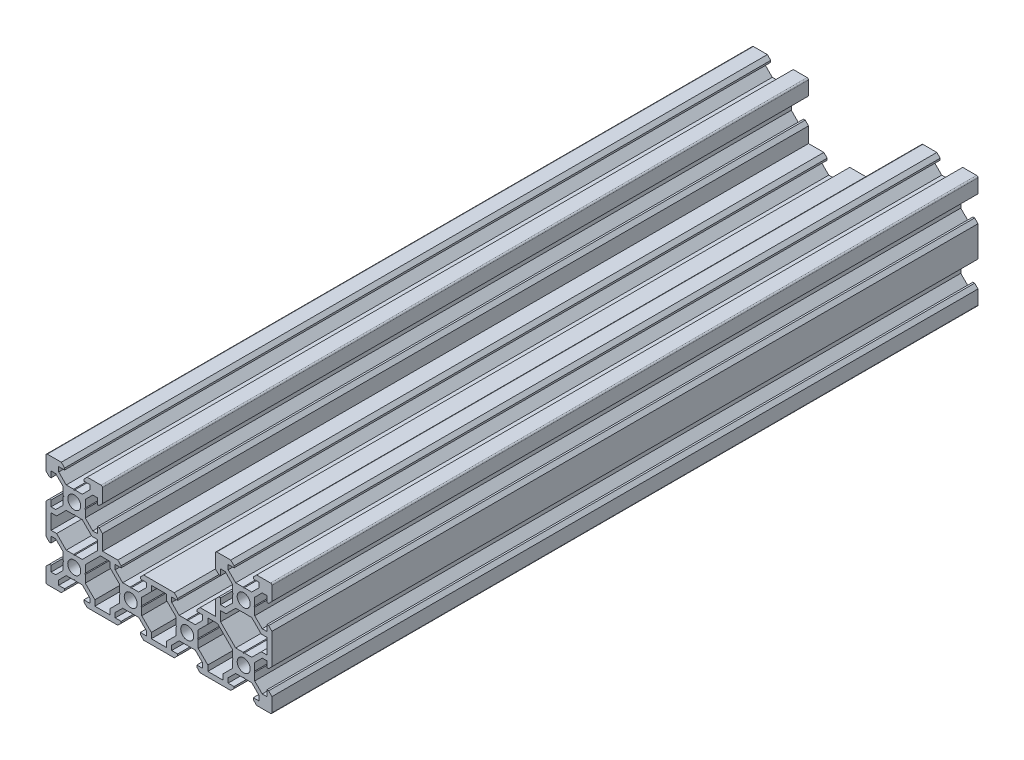
from build123d import *

# Parameters (mm, degrees)
ESQUISSE1_R             = 2.3
BOSS_EXTRU_1_DEPTH      = 250
ENL_V_MAT_EXTRU_1_DEPTH = 254.574446662


with BuildPart() as part:
    # Esquisse1 → Boss.-Extru.1 (new body)
    with BuildSketch(Plane.XY):
        with BuildLine():
            Line((-3.9, 2.839339828), (-6.560660172, 5.5))
            Line((-6.560660172, 5.5), (-8.2, 5.5))
            Line((-8.2, 5.5), (-8.2, 3.395))
            Line((-8.2, 3.395), (-8.815, 3.395))
            Line((-8.815, 3.395), (-10, 4.58))
            Line((-10, 4.58), (-10, 9.5))
            ThreePointArc((-10, 9.5), (-9.853553391, 9.853553391), (-9.5, 10))
            Line((-9.5, 10), (-4.58, 10))
            Line((-4.58, 10), (-3.395, 8.815))
            Line((-3.395, 8.815), (-3.395, 8.2))
            Line((-3.395, 8.2), (-5.5, 8.2))
            Line((-5.5, 8.2), (-5.5, 6.560660172))
            Line((-5.5, 6.560660172), (-2.839339828, 3.9))
            Line((-2.839339828, 3.9), (2.839339828, 3.9))
            Line((2.839339828, 3.9), (5.5, 6.560660172))
            Line((5.5, 6.560660172), (5.5, 8.2))
            Line((5.5, 8.2), (3.395, 8.2))
            Line((3.395, 8.2), (3.395, 8.815))
            Line((3.395, 8.815), (4.58, 10))
            Line((4.58, 10), (9.5, 10))
            ThreePointArc((9.5, 10), (9.853553391, 9.853553391), (10, 9.5))
            Line((10, 9.5), (10, 4.58))
            Line((10, 4.58), (8.815, 3.395))
            Line((8.815, 3.395), (8.2, 3.395))
            Line((8.2, 3.395), (8.2, 5.5))
            Line((8.2, 5.5), (6.560660172, 5.5))
            Line((6.560660172, 5.5), (3.9, 2.839339828))
            Line((3.9, 2.839339828), (3.9, -2.839339828))
            Line((3.9, -2.839339828), (6.560660172, -5.5))
            Line((6.560660172, -5.5), (8.2, -5.5))
            Line((8.2, -5.5), (8.2, -3.395))
            Line((8.2, -3.395), (8.815, -3.395))
            Line((8.815, -3.395), (10, -4.58))
            Line((10, -4.58), (10, -10))
            Line((10, -10), (15.42, -10))
            Line((15.42, -10), (16.605, -11.185))
            Line((16.605, -11.185), (16.605, -11.8))
            Line((16.605, -11.8), (14.5, -11.8))
            Line((14.5, -11.8), (14.5, -13.439339828))
            Line((14.5, -13.439339828), (17.160660172, -16.1))
            Line((17.160660172, -16.1), (22.839339828, -16.1))
            Line((22.839339828, -16.1), (25.5, -13.439339828))
            Line((25.5, -13.439339828), (25.5, -11.8))
            Line((25.5, -11.8), (23.395, -11.8))
            Line((23.395, -11.8), (23.395, -11.185))
            Line((23.395, -11.185), (24.58, -10))
            Line((24.58, -10), (30, -10))
            Line((30, -10), (30, -11.8))
            Line((30, -11.8), (27.3, -11.8))
            Line((27.3, -11.8), (27.3, -13.760660172))
            Line((27.3, -13.760660172), (23.9, -17.160660172))
            Line((23.9, -17.160660172), (23.9, -22.839339828))
            Line((23.9, -22.839339828), (27.3, -26.239339828))
            Line((27.3, -26.239339828), (27.3, -28.2))
            Line((27.3, -28.2), (30, -28.2))
            Line((30, -28.2), (30, -30))
            Line((30, -30), (24.58, -30))
            Line((24.58, -30), (23.395, -28.815))
            Line((23.395, -28.815), (23.395, -28.2))
            Line((23.395, -28.2), (25.5, -28.2))
            Line((25.5, -28.2), (25.5, -26.560660172))
            Line((25.5, -26.560660172), (22.839339828, -23.9))
            Line((22.839339828, -23.9), (17.160660172, -23.9))
            Line((17.160660172, -23.9), (14.5, -26.560660172))
            Line((14.5, -26.560660172), (14.5, -28.2))
            Line((14.5, -28.2), (16.605, -28.2))
            Line((16.605, -28.2), (16.605, -28.815))
            Line((16.605, -28.815), (15.42, -30))
            Line((15.42, -30), (4.58, -30))
            Line((4.58, -30), (3.395, -28.815))
            Line((3.395, -28.815), (3.395, -28.2))
            Line((3.395, -28.2), (5.5, -28.2))
            Line((5.5, -28.2), (5.5, -26.560660172))
            Line((5.5, -26.560660172), (2.839339828, -23.9))
            Line((2.839339828, -23.9), (-2.839339828, -23.9))
            Line((-2.839339828, -23.9), (-5.5, -26.560660172))
            Line((-5.5, -26.560660172), (-5.5, -28.2))
            Line((-5.5, -28.2), (-3.395, -28.2))
            Line((-3.395, -28.2), (-3.395, -28.815))
            Line((-3.395, -28.815), (-4.58, -30))
            Line((-4.58, -30), (-9.5, -30))
            ThreePointArc((-9.5, -30), (-9.853553391, -29.853553391), (-10, -29.5))
            Line((-10, -29.5), (-10, -24.58))
            Line((-10, -24.58), (-8.815, -23.395))
            Line((-8.815, -23.395), (-8.2, -23.395))
            Line((-8.2, -23.395), (-8.2, -25.5))
            Line((-8.2, -25.5), (-6.560660172, -25.5))
            Line((-6.560660172, -25.5), (-3.9, -22.839339828))
            Line((-3.9, -22.839339828), (-3.9, -17.160660172))
            Line((-3.9, -17.160660172), (-6.560660172, -14.5))
            Line((-6.560660172, -14.5), (-8.2, -14.5))
            Line((-8.2, -14.5), (-8.2, -16.605))
            Line((-8.2, -16.605), (-8.815, -16.605))
            Line((-8.815, -16.605), (-10, -15.42))
            Line((-10, -15.42), (-10, -4.58))
            Line((-10, -4.58), (-8.815, -3.395))
            Line((-8.815, -3.395), (-8.2, -3.395))
            Line((-8.2, -3.395), (-8.2, -5.5))
            Line((-8.2, -5.5), (-6.560660172, -5.5))
            Line((-6.560660172, -5.5), (-3.9, -2.839339828))
            Line((-3.9, -2.839339828), (-3.9, 2.839339828))
        make_face()
        Circle(ESQUISSE1_R, mode=Mode.SUBTRACT)
        with Locations((0, -20)):
            Circle(ESQUISSE1_R, mode=Mode.SUBTRACT)
        with Locations((20, -20)):
            Circle(ESQUISSE1_R, mode=Mode.SUBTRACT)
        Polygon((-2.839339828, -3.9), (-6.239339828, -7.3), (-8.2, -7.3), (-8.2, -12.7), (-6.239339828, -12.7), (-2.839339828, -16.1), (2.839339828, -16.1), (8.2, -10.739339828), (8.2, -7.3), (6.239339828, -7.3), (2.839339828, -3.9), align=None, mode=Mode.SUBTRACT)
        Polygon((3.9, -22.839339828), (7.3, -26.239339828), (7.3, -28.2), (12.7, -28.2), (12.7, -26.239339828), (16.1, -22.839339828), (16.1, -17.160660172), (12.7, -13.760660172), (12.7, -11.8), (9.260660172, -11.8), (3.9, -17.160660172), align=None, mode=Mode.SUBTRACT)
    boss_extru_1 = extrude(amount=BOSS_EXTRU_1_DEPTH)

    # Esquisse2 → Enlèv. mat.-Extru.1 (cut, through all)
    with BuildSketch(Plane.XY.offset(250)):
        Polygon((-0.21, 3.9), (0, 3.69), (0.21, 3.9), align=None)
        Polygon((3.9, -0.21), (3.9, 0.21), (3.69, 0), align=None)
        Polygon((0.21, -3.9), (0, -3.69), (-0.21, -3.9), align=None)
        Polygon((-3.9, 0.21), (-3.9, -0.21), (-3.69, 0), align=None)
        Polygon((-3.9, -20.21), (-3.69, -20), (-3.9, -19.79), align=None)
        Polygon((0.21, -16.1), (-0.21, -16.1), (0, -16.31), align=None)
        Polygon((3.9, -19.79), (3.69, -20), (3.9, -20.21), align=None)
        Polygon((-0.21, -23.9), (0.21, -23.9), (0, -23.69), align=None)
        Polygon((20.21, -23.9), (20, -23.69), (19.79, -23.9), align=None)
        Polygon((16.1, -19.79), (16.1, -20.21), (16.31, -20), align=None)
        Polygon((19.79, -16.1), (20, -16.31), (20.21, -16.1), align=None)
        Polygon((23.9, -20.21), (23.9, -19.79), (23.69, -20), align=None)
    enl_v_mat_extru_1 = extrude(amount=-ENL_V_MAT_EXTRU_1_DEPTH, mode=Mode.SUBTRACT)

    # Symétrie1: Boss.-Extru.1, Enlèv. mat.-Extru.1 across plane
    add(boss_extru_1.mirror(Plane(origin=(30, -10, 250), x_dir=(0, 0, 1), z_dir=(-1, 0, 0))))
    add(enl_v_mat_extru_1.mirror(Plane(origin=(30, -10, 250), x_dir=(0, 0, 1), z_dir=(-1, 0, 0))), mode=Mode.SUBTRACT)


solid = part.part
